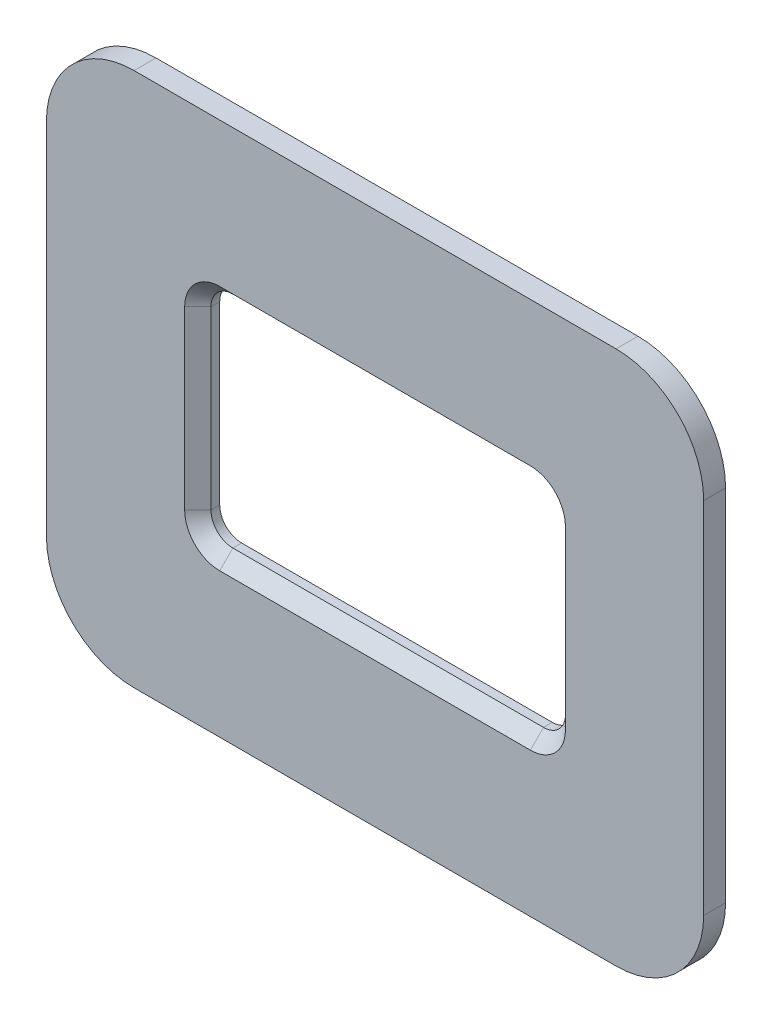
from build123d import *

# Parameters (mm, degrees)
EXTRUDE_1_DEPTH = 5
CHAMFER_1_SIZE  = 3


with BuildPart() as part:
    # 草图1 → 凸台-拉伸1 (new body)
    with BuildSketch(Plane.XY):
        with BuildLine():
            Line((-55, -61), (55, -61))
            ThreePointArc((55, -61), (69.142135624, -55.142135624), (75, -41))
            Line((75, -41), (75, 41))
            ThreePointArc((75, 41), (69.142135624, 55.142135624), (55, 61))
            Line((55, 61), (-55, 61))
            ThreePointArc((-55, 61), (-69.142135624, 55.142135624), (-75, 41))
            Line((-75, 41), (-75, -41))
            ThreePointArc((-75, -41), (-69.142135624, -55.142135624), (-55, -61))
        make_face()
        with BuildLine():
            Line((-35.45, -25.1), (35.45, -25.1))
            ThreePointArc((35.45, -25.1), (38.985533906, -23.635533906), (40.45, -20.1))
            Line((40.45, -20.1), (40.45, 20.1))
            ThreePointArc((40.45, 20.1), (38.985533906, 23.635533906), (35.45, 25.1))
            Line((35.45, 25.1), (-35.45, 25.1))
            ThreePointArc((-35.45, 25.1), (-38.985533906, 23.635533906), (-40.45, 20.1))
            Line((-40.45, 20.1), (-40.45, -20.1))
            ThreePointArc((-40.45, -20.1), (-38.985533906, -23.635533906), (-35.45, -25.1))
        make_face(mode=Mode.SUBTRACT)
    extrude(amount=EXTRUDE_1_DEPTH)

    # 倒角1
    chamfer_1_edges = [part.edges().sort_by_distance(p)[0] for p in [
        (0, -25.1, 5),
        (38.985533906, -23.635533906, 5),
        (-38.985533906, -23.635533906, 5),
        (40.45, 0, 5),
        (-40.45, 0, 5),
        (38.985533906, 23.635533906, 5),
        (-38.985533906, 23.635533906, 5),
        (0, 25.1, 5),
    ]]
    chamfer(chamfer_1_edges, length=CHAMFER_1_SIZE)


solid = part.part
